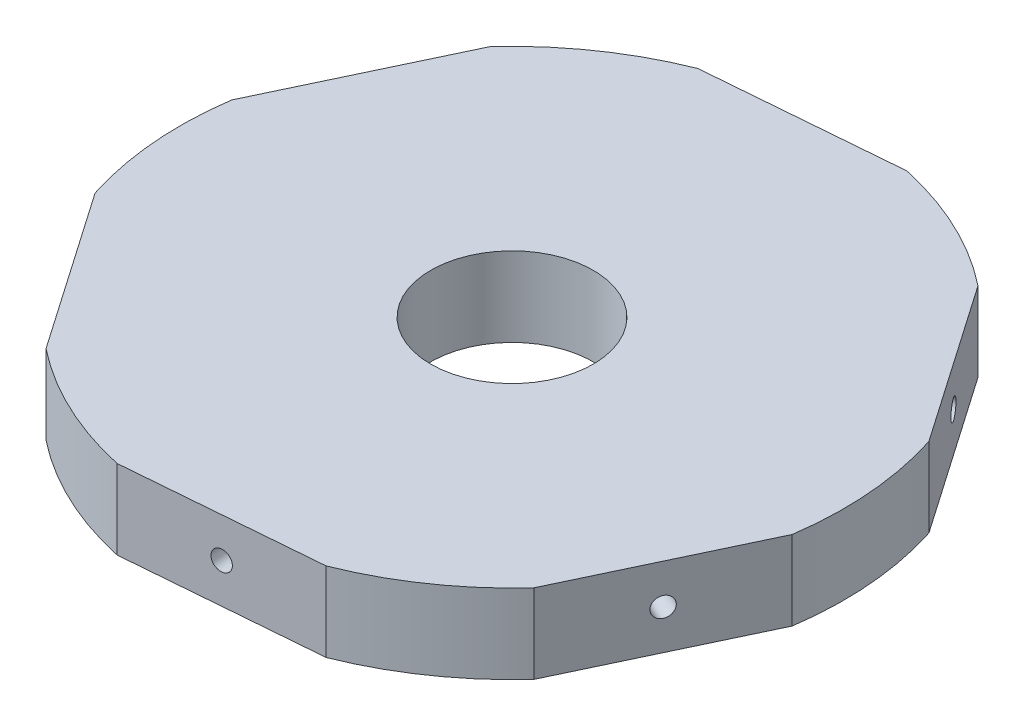
from build123d import *

# Parameters (mm, degrees)
SKETCH2_R           = 20.5
BOSS_EXTRUDE1_DEPTH = 20
SKETCH3_R           = 2.5
CUT_EXTRUDE1_DEPTH  = 20
CIRPATTERN1_COUNT   = 6


with BuildPart() as part:
    # Sketch2 → Boss-Extrude1 (new body)
    with BuildSketch(Plane(origin=(0, 0, 0), x_dir=(1, 0, 0), z_dir=(0, 1, 0))):
        with BuildLine():
            Line((17.837491635, 81.728258153), (-30.89458828, 77.738077565))
            ThreePointArc((-30.89458828, 77.738077565), (-47.598574657, 68.789970047), (-61.86000195, 56.311849972))
            Line((-61.86000195, 56.311849972), (-82.770444153, 12.113540492))
            ThreePointArc((-82.770444153, 12.113540492), (-83.373148915, -6.826589814), (-79.697493585, -25.416408181))
            Line((-79.697493585, -25.416408181), (-51.875855872, -65.624537073))
            ThreePointArc((-51.875855872, -65.624537073), (-35.774574258, -75.616559861), (-17.837491635, -81.728258153))
            Line((-17.837491635, -81.728258153), (30.89458828, -77.738077565))
            ThreePointArc((30.89458828, -77.738077565), (47.598574657, -68.789970047), (61.86000195, -56.311849972))
            Line((61.86000195, -56.311849972), (82.770444153, -12.113540492))
            ThreePointArc((82.770444153, -12.113540492), (83.373148915, 6.826589814), (79.697493585, 25.416408181))
            Line((79.697493585, 25.416408181), (51.875855872, 65.624537073))
            ThreePointArc((51.875855872, 65.624537073), (35.774574258, 75.616559861), (17.837491635, 81.728258153))
        make_face()
        Circle(SKETCH2_R, mode=Mode.SUBTRACT)
    extrude(amount=BOSS_EXTRUDE1_DEPTH)

    # Sketch3 → Cut-Extrude1 (cut)
    with BuildSketch(Plane(origin=(6.528548323, 0, 79.733167859), x_dir=(0.9966645982347733, 0, -0.08160685403517359), z_dir=(0.0816068540351736, 0, 0.9966645982347733))):
        with Locations((0, 10)):
            Circle(SKETCH3_R)
    cut_extrude1 = extrude(amount=-CUT_EXTRUDE1_DEPTH, mode=Mode.SUBTRACT)

    # CirPattern1: Cut-Extrude1 ×6 about axis
    cirpattern1_axis = Axis((0, 20, 0), (0, 1, 0))
    for i in range(1, CIRPATTERN1_COUNT):
        add(cut_extrude1.rotate(cirpattern1_axis, i * 360 / CIRPATTERN1_COUNT), mode=Mode.SUBTRACT)


solid = part.part
